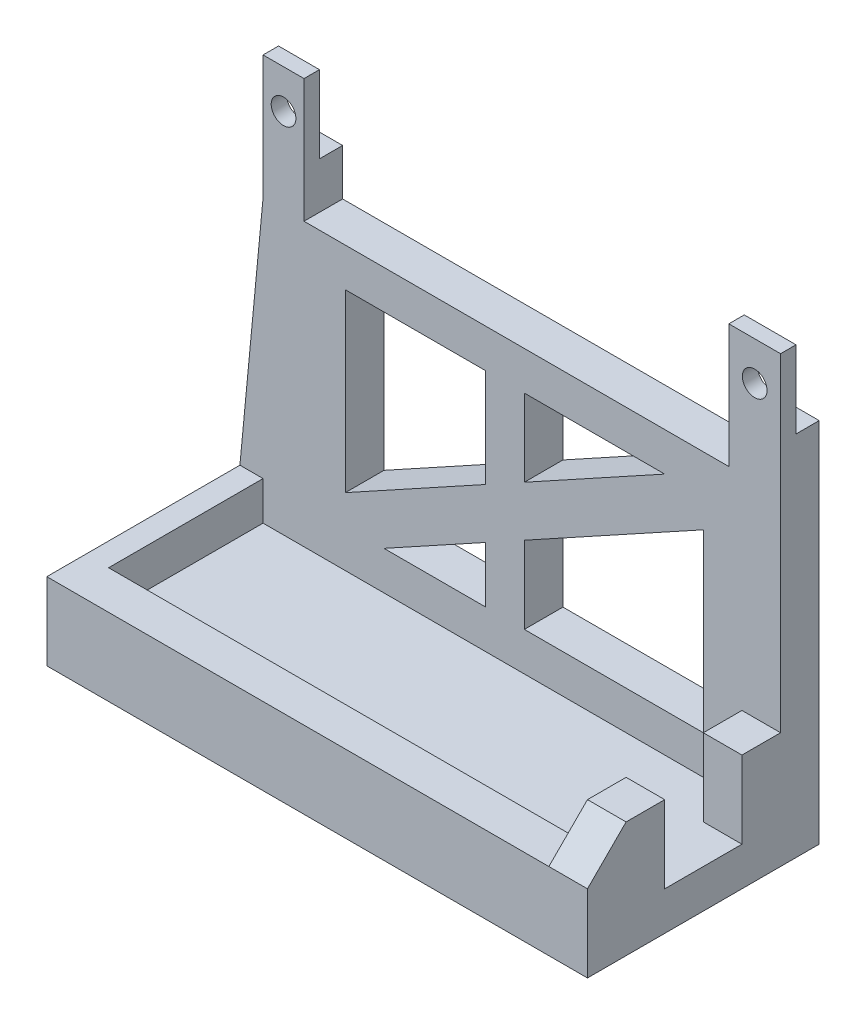
from build123d import *

# Parameters (mm, degrees)
SKETCH2_W            = 70
SKETCH2_H            = 20
BOSS_EXTRUDE1_DEPTH  = 5
SKETCH3_W            = 70
SKETCH3_H            = 5
BOSS_EXTRUDE2_DEPTH  = 10
SKETCH4_W            = 5
SKETCH4_H            = 5
BOSS_EXTRUDE3_DEPTH  = 10
LOFT1_START          = -5
LOFT1_DEPTH          = 5
SKETCH7_W            = 3
SKETCH7_H            = 20
BOSS_EXTRUDE4_DEPTH  = 5
LOFT2_START          = -5
LOFT2_DEPTH          = 5
BOSS_EXTRUDE5_DEPTH  = 5
SKETCH12_W           = 46.347010245
SKETCH12_H           = 26.5
CUT_EXTRUDE1_DEPTH   = 14
BOSS_EXTRUDE6_DEPTH  = 5
BOSS_EXTRUDE7_DEPTH  = 5
SKETCH17_W           = 6.7
SKETCH17_H           = 6
BOSS_EXTRUDE8_DEPTH  = 5
SKETCH18_W           = 5.3
SKETCH18_H           = 6
BOSS_EXTRUDE9_DEPTH  = 5
SKETCH23_W           = 6.7
SKETCH23_H           = 2
SKETCH23_W_2         = 5.3
BOSS_EXTRUDE12_DEPTH = 10
SKETCH24_R           = 1.6
CUT_EXTRUDE4_DEPTH   = 10


# Read off the part's stored shape, not the designer's step: Loft1, Loft2
with BuildPart() as part:
    # Sketch2 → Boss-Extrude1 (new body)
    with BuildSketch(Plane(origin=(0, 0, 0), x_dir=(1, 0, 0), z_dir=(0, 1, 0))):
        with Locations((-35, 10)):
            Rectangle(SKETCH2_W, SKETCH2_H)
    extrude(amount=BOSS_EXTRUDE1_DEPTH)

    # Sketch3 → Boss-Extrude2 (add)
    with BuildSketch(Plane(origin=(0, 0, 0), x_dir=(1, 0, 0), z_dir=(0, 1, 0))):
        with Locations((-35, 22.5)):
            Rectangle(SKETCH3_W, SKETCH3_H)
        with Locations((-35, -2.5)):
            Rectangle(SKETCH3_W, SKETCH3_H)
    extrude(amount=BOSS_EXTRUDE2_DEPTH)

    # Sketch4 → Boss-Extrude3 (add)
    with BuildSketch(Plane(origin=(0, 5, 0), x_dir=(1, 0, 0), z_dir=(0, 1, 0))):
        with Locations((-2.5, 2.5)):
            Rectangle(SKETCH4_W, SKETCH4_H)
        with Locations((-2.5, 17.5)):
            Rectangle(SKETCH4_W, SKETCH4_H)
    extrude(amount=BOSS_EXTRUDE3_DEPTH)

    # Loft1 outline → Loft1 (add)
    with BuildSketch(Plane.YZ.offset(LOFT1_START)):
        Polygon((15, 0), (10, 5), (10, 0), align=None)
    extrude(amount=LOFT1_DEPTH)

    # Sketch7 → Boss-Extrude4 (add)
    with BuildSketch(Plane(origin=(0, 5, 0), x_dir=(1, 0, 0), z_dir=(0, 1, 0))):
        with Locations((-68.5, 10)):
            Rectangle(SKETCH7_W, SKETCH7_H)
    extrude(amount=BOSS_EXTRUDE4_DEPTH)

    # Loft2 outline → Loft2 (add)
    with BuildSketch(Plane.YZ.offset(LOFT2_START)):
        Polygon((10, -25), (15, -20), (10, -20), align=None)
    extrude(amount=LOFT2_DEPTH)

    # Sketch10 → Boss-Extrude5 (add)
    with BuildSketch(Plane(origin=(0, 0, -25), x_dir=(-1, 0, 0), z_dir=(0, 0, -1))):
        Polygon((0, 10), (0, 41.5), (67, 41.5), (70, 10), align=None)
    extrude(amount=-BOSS_EXTRUDE5_DEPTH)

    # Sketch12 → Cut-Extrude1 (cut)
    with BuildSketch(Plane(origin=(0, 0, -25), x_dir=(-1, 0, 0), z_dir=(0, 0, -1))):
        with Locations((33.173505123, 23.25)):
            Rectangle(SKETCH12_W, SKETCH12_H)
    extrude(amount=-CUT_EXTRUDE1_DEPTH, mode=Mode.SUBTRACT)

    # Sketch13 → Boss-Extrude6 (add)
    with BuildSketch(Plane(origin=(0, 0, -25), x_dir=(-1, 0, 0), z_dir=(0, 0, -1))):
        Polygon((15, 30), (51.347010245, 10), (56.347010245, 10), (56.347010245, 13.748742075), (51.347010245, 16.5), (15, 36.5), (10, 36.5), (10, 32.751257925), align=None)
    extrude(amount=-BOSS_EXTRUDE6_DEPTH)

    # Sketch14 → Boss-Extrude7 (add)
    with BuildSketch(Plane(origin=(0, 0, -25), x_dir=(-1, 0, 0), z_dir=(0, 0, -1))):
        Polygon((35.673505122, 36.5), (33.173505122, 36.5), (33.173505122, 10), (38.173505122, 10), (38.173505122, 36.5), align=None)
    extrude(amount=-BOSS_EXTRUDE7_DEPTH)

    # Sketch17 → Boss-Extrude8 (add)
    with BuildSketch(Plane(origin=(0, 0, -25), x_dir=(-1, 0, 0), z_dir=(0, 0, -1))):
        with Locations((3.35, 44.5)):
            Rectangle(SKETCH17_W, SKETCH17_H)
    extrude(amount=-BOSS_EXTRUDE8_DEPTH)

    # Sketch18 → Boss-Extrude9 (add)
    with BuildSketch(Plane(origin=(0, 0, -25), x_dir=(-1, 0, 0), z_dir=(0, 0, -1))):
        with Locations((64.35, 44.5)):
            Rectangle(SKETCH18_W, SKETCH18_H)
    extrude(amount=-BOSS_EXTRUDE9_DEPTH)

    # Sketch23 → Boss-Extrude12 (add)
    with BuildSketch(Plane(origin=(0, 47.5, 0), x_dir=(1, 0, 0), z_dir=(0, 1, 0))):
        with Locations((-3.35, 21)):
            Rectangle(SKETCH23_W, SKETCH23_H)
        with Locations((-64.35, 21)):
            Rectangle(SKETCH23_W_2, SKETCH23_H)
    extrude(amount=BOSS_EXTRUDE12_DEPTH)

    # Sketch24 → Cut-Extrude4 (cut)
    with BuildSketch(Plane(origin=(0, 0, -22), x_dir=(-1, 0, 0), z_dir=(0, 0, -1))):
        with Locations((3.35, 52.5)):
            Circle(SKETCH24_R)
        with Locations((64.35, 52.5)):
            Circle(SKETCH24_R)
    extrude(amount=-CUT_EXTRUDE4_DEPTH, mode=Mode.SUBTRACT)


solid = part.part
